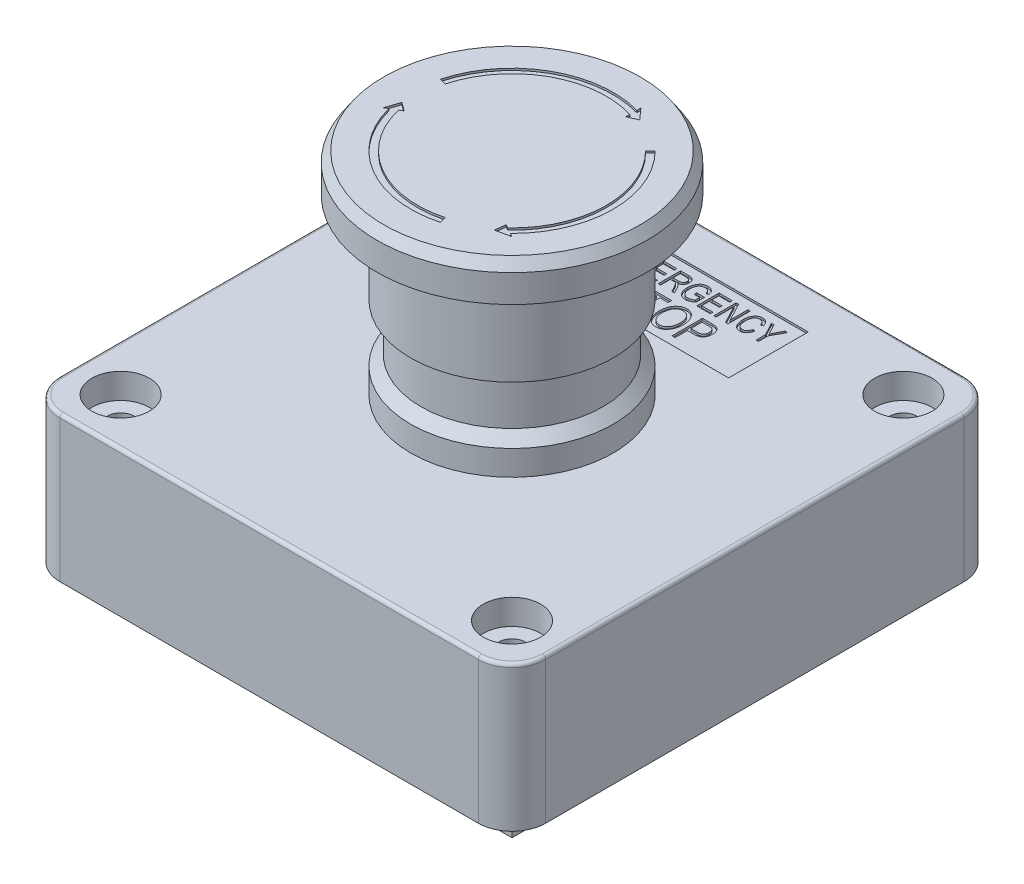
from build123d import *

# Parameters (mm, degrees)
SKETCH1_W               = 72
SKETCH1_H               = 72
BOSS_EXTRUDE1_DEPTH     = 21.5
FILLET1_R               = 5
CUT_EXTRUDE1_DEPTH      = 18.13
CUT_EXTRUDE2_DEPTH      = 56.265269383
CUT_EXTRUDE2_DEPTH_BACK = 56.265269383
SKETCH3_R               = 2
FILLET2_R               = 2
CUT_EXTRUDE3_DEPTH      = 56.265269383
CUT_EXTRUDE3_DEPTH_BACK = 0.3
SKETCH4_W               = 27.8
SKETCH4_H               = 11.8
CUT_EXTRUDE4_DEPTH      = 0.3
SKETCH8_R               = 4.25
CUT_EXTRUDE5_DEPTH      = 3.75
FILLET3_R               = 0.5
SKETCH9_R               = 12.5
BOSS_EXTRUDE2_DEPTH     = 10
BOSS_EXTRUDE3_DEPTH     = 6
SKETCH11_W              = 27
SKETCH11_H              = 27
BOSS_EXTRUDE4_DEPTH     = 24
CUT_EXTRUDE6_DEPTH      = 0.3


with BuildPart() as part:
    # Sketch1 → Boss-Extrude1 (new body)
    with BuildSketch(Plane(origin=(0, 0, 0), x_dir=(1, 0, 0), z_dir=(0, 1, 0))):
        Rectangle(SKETCH1_W, SKETCH1_H)
    extrude(amount=BOSS_EXTRUDE1_DEPTH)

    # Fillet1
    fillet1_edges = [part.edges().sort_by_distance(p)[0] for p in [
        (-36, 10.75, -36),
        (-36, 10.75, 36),
        (36, 10.75, -36),
        (36, 10.75, 36),
    ]]
    fillet(fillet1_edges, radius=FILLET1_R)

    # Sketch2 → Cut-Extrude1 (cut)
    with BuildSketch(Plane.XZ):
        Polygon((31, 12.3), (31, -16.4), (21.801694134, -26.5), (21.801694134, -31), (-21, -31), (-21, -13.290085662), (-31, -13.290085662), (-31, 15.409914338), (-20.9, 26.5), (-20.9, 31), (21, 31), (21, 12.3), align=None)
    extrude(amount=-CUT_EXTRUDE1_DEPTH, mode=Mode.SUBTRACT)

    # Sketch3 → Cut-Extrude2 (cut, two sides: drawn at the far end of the back side and taken through both)
    with BuildSketch(Plane(origin=(0, 21.5, 0), x_dir=(1, 0, 0), z_dir=(0, 1, 0)).offset(-CUT_EXTRUDE2_DEPTH_BACK)):
        with Locations((-29, 29)):
            Circle(SKETCH3_R)
        with Locations((29, 29)):
            Circle(SKETCH3_R)
        with Locations((29, -29)):
            Circle(SKETCH3_R)
        with Locations((-29, -29)):
            Circle(SKETCH3_R)
    extrude(amount=CUT_EXTRUDE2_DEPTH + CUT_EXTRUDE2_DEPTH_BACK, mode=Mode.SUBTRACT)

    # Fillet2
    fillet2_edges = [part.edges().sort_by_distance(p)[0] for p in [
        (-20.9, 9.065, 31),
        (21, 9.065, 31),
        (21, 9.065, 12.3),
        (31, 9.065, 12.3),
        (31, 9.065, -16.4),
        (21.801694134, 9.065, -26.5),
        (21.801694134, 9.065, -31),
        (-21, 9.065, -31),
        (-31, 9.065, -13.290085662),
        (-21, 9.065, -13.290085662),
        (-31, 9.065, 15.409914338),
        (-20.9, 9.065, 26.5),
    ]]
    fillet(fillet2_edges, radius=FILLET2_R)

    # Sketch4 → Cut-Extrude3 (cut, two sides: drawn at the far end of the back side and taken through both)
    with BuildSketch(Plane(origin=(0, 21.5, 0), x_dir=(1, 0, 0), z_dir=(0, 1, 0)).offset(-CUT_EXTRUDE3_DEPTH_BACK)):
        with Locations((0, 24.1)):
            Rectangle(SKETCH4_W, SKETCH4_H)
    extrude(amount=CUT_EXTRUDE3_DEPTH + CUT_EXTRUDE3_DEPTH_BACK, mode=Mode.SUBTRACT)

    # Sketch6 → Revolve2 (revolve)
    with BuildSketch(Plane.XY):
        Polygon((0, 21.5), (15, 21.5), (15, 25.2), (13.5, 26.7), (13.5, 33.7), (15, 33.7), (15, 47.2), (20, 47.2), (20, 51.3), (19, 52.8), (0, 52.8), align=None)
    revolve(axis=Axis((0, 0, 0), (0, 1, 0)))

    # Sketch7 → Cut-Extrude4 (cut)
    # profile 1 of 13: a face of its own
    with BuildSketch(Plane(origin=(0, 21.2, 0), x_dir=(1, 0, 0), z_dir=(0, 1, 0))):
        Polygon((-11.935714286, 25.386938867), (-11.935714286, 28.686938867), (-9.964285714, 28.686938867), (-9.964285714, 28.301224581), (-11.592857143, 28.301224581), (-11.592857143, 27.272653153), (-10.05, 27.272653153), (-10.05, 26.886938867), (-11.592857143, 26.886938867), (-11.592857143, 25.772653153), (-9.921428571, 25.772653153), (-9.921428571, 25.386938867), align=None)
    # profile 2 of 13: a face of its own
    with BuildSketch(Plane(origin=(0, 21.2, 0), x_dir=(1, 0, 0), z_dir=(0, 1, 0))):
        with BuildLine():
            Line((-9.407142857, 25.386938867), (-9.407142857, 28.686938867))
            Line((-9.407142857, 28.686938867), (-8.870758929, 28.686938867))
            Line((-8.870758929, 28.686938867), (-8.228571429, 26.350554938))
            Line((-8.228571429, 26.350554938), (-8.1, 25.861715653))
            add(Edge.make_bspline(
                [(-8.1, 25.861715653), (-8.09580599, 25.877799765), (-8.086993225, 25.911596892), (-8.072040154, 25.964887601), (-8.055168036, 26.023207661), (-8.038152733, 26.087058482), (-8.018507157, 26.155524866), (-7.996972068, 26.229089658), (-7.974241018, 26.308118688), (-7.958695008, 26.362605574), (-7.950669643, 26.39073351)],
                knots=[0, 0, 0, 0, 0.72569615, 1.52488642, 2.416426408, 3.376296137, 4.409732583, 5.526177123, 6.722930645, 8, 8, 8, 8], degree=3))
            Line((-7.950669643, 26.39073351), (-7.278348214, 28.686938867))
            Line((-7.278348214, 28.686938867), (-6.792857143, 28.686938867))
            Line((-6.792857143, 28.686938867), (-6.792857143, 25.386938867))
            Line((-6.792857143, 25.386938867), (-7.135714286, 25.386938867))
            Line((-7.135714286, 25.386938867), (-7.135714286, 28.11104601))
            Line((-7.135714286, 28.11104601), (-7.927901786, 25.386938867))
            Line((-7.927901786, 25.386938867), (-8.278794643, 25.386938867))
            Line((-8.278794643, 25.386938867), (-9.064285714, 28.267072795))
            Line((-9.064285714, 28.267072795), (-9.064285714, 25.386938867))
            Line((-9.064285714, 25.386938867), (-9.407142857, 25.386938867))
        make_face()
    # profile 3 of 13: a face of its own
    with BuildSketch(Plane(origin=(0, 21.2, 0), x_dir=(1, 0, 0), z_dir=(0, 1, 0))):
        Polygon((-6.235714286, 25.386938867), (-6.235714286, 28.686938867), (-4.264285714, 28.686938867), (-4.264285714, 28.301224581), (-5.892857143, 28.301224581), (-5.892857143, 27.272653153), (-4.35, 27.272653153), (-4.35, 26.886938867), (-5.892857143, 26.886938867), (-5.892857143, 25.772653153), (-4.221428571, 25.772653153), (-4.221428571, 25.386938867), align=None)
    # profile 4 of 13: a face of its own
    with BuildSketch(Plane(origin=(0, 21.2, 0), x_dir=(1, 0, 0), z_dir=(0, 1, 0))):
        with BuildLine():
            Line((-3.707142857, 25.386938867), (-3.707142857, 28.686938867))
            Line((-3.707142857, 28.686938867), (-2.495089286, 28.686938867))
            add(Edge.make_bspline(
                [(-2.495089286, 28.686938867), (-2.464501753, 28.686762801), (-2.405296434, 28.686422009), (-2.319528953, 28.68151951), (-2.239778603, 28.674262263), (-2.166151633, 28.664612953), (-2.099077856, 28.651235194), (-2.038291278, 28.635007012), (-1.983297374, 28.616892967), (-1.918736611, 28.587013686), (-1.845080961, 28.540667961), (-1.765643396, 28.470057906), (-1.696062565, 28.382616466), (-1.634145944, 28.282149706), (-1.583298101, 28.169349319), (-1.547280302, 28.046333646), (-1.525537065, 27.914718958), (-1.522821889, 27.8240774), (-1.521428571, 27.777563867)],
                knots=[0, 0, 0, 0, 0.957775898, 1.853873864, 2.6892683, 3.465319774, 4.178195347, 4.829309051, 5.435011313, 5.988660553, 7.053440284, 8.147710094, 9.30058322, 10.540256924, 11.835580405, 13.162637032, 14.543981594, 16, 16, 16, 16], degree=3))
            add(Edge.make_bspline(
                [(-1.521428571, 27.777563867), (-1.522157073, 27.74674054), (-1.523580063, 27.686532947), (-1.53220016, 27.598288282), (-1.547179898, 27.514583581), (-1.570088836, 27.435635435), (-1.596657587, 27.360462782), (-1.631545778, 27.290383354), (-1.671573329, 27.224492076), (-1.718096702, 27.163312675), (-1.770134804, 27.106981577), (-1.828536729, 27.056384235), (-1.892166907, 27.010802188), (-1.96152148, 26.970635671), (-2.036171216, 26.935370542), (-2.11699912, 26.907230465), (-2.202745471, 26.882587464), (-2.262389386, 26.871284276), (-2.292857143, 26.865510295)],
                knots=[0, 0, 0, 0, 1.121977975, 2.191573688, 3.224240956, 4.211948119, 5.180998842, 6.122125515, 7.055751929, 7.983633331, 8.914994346, 9.842128418, 10.791356962, 11.759862547, 12.75578979, 13.791489111, 14.871831714, 16, 16, 16, 16], degree=3))
            add(Edge.make_bspline(
                [(-2.292857143, 26.865510295), (-2.27036884, 26.853068063), (-2.227559839, 26.82938288), (-2.168974159, 26.791169106), (-2.118905971, 26.752705058), (-2.090601961, 26.724714292), (-2.077232143, 26.711492438)],
                knots=[0, 0, 0, 0, 1.158843086, 2.205987482, 3.152571606, 4, 4, 4, 4], degree=3))
            add(Edge.make_bspline(
                [(-2.077232143, 26.711492438), (-2.050490669, 26.679214406), (-1.996707016, 26.614295376), (-1.922978184, 26.510725204), (-1.852355677, 26.402983255), (-1.810882815, 26.327192348), (-1.789955357, 26.288947795)],
                knots=[0, 0, 0, 0, 0.982253192, 1.975551771, 2.978451105, 4, 4, 4, 4], degree=3))
            Line((-1.789955357, 26.288947795), (-1.307142857, 25.386938867))
            Line((-1.307142857, 25.386938867), (-1.696875, 25.386938867))
            Line((-1.696875, 25.386938867), (-2.077901786, 26.092742438))
            add(Edge.make_bspline(
                [(-2.077901786, 26.092742438), (-2.095651741, 26.125836639), (-2.129603168, 26.189137944), (-2.179990609, 26.279016463), (-2.226829263, 26.360073571), (-2.270040029, 26.432388323), (-2.310263275, 26.495193535), (-2.346389608, 26.549352239), (-2.379474614, 26.594247678), (-2.41907213, 26.640503539), (-2.465097809, 26.68845247), (-2.519811148, 26.736608226), (-2.574460942, 26.773939546), (-2.630101921, 26.802368554), (-2.691350689, 26.821096743), (-2.760365996, 26.835115033), (-2.840234942, 26.842739923), (-2.896860196, 26.843615529), (-2.927008929, 26.844081724)],
                knots=[0, 0, 0, 0, 1.483643366, 2.83785556, 4.070616892, 5.1822306, 6.165666296, 7.016844219, 7.754091418, 8.367230408, 9.421242841, 10.377779407, 11.241203819, 12.029974219, 12.835959019, 13.762973995, 14.808950166, 16, 16, 16, 16], degree=3))
            Line((-2.927008929, 26.844081724), (-3.364285714, 26.844081724))
            Line((-3.364285714, 26.844081724), (-3.364285714, 25.386938867))
            Line((-3.364285714, 25.386938867), (-3.707142857, 25.386938867))
        make_face()
        with BuildLine():
            Line((-3.364285714, 27.22979601), (-2.560044643, 27.22979601))
            add(Edge.make_bspline(
                [(-2.560044643, 27.22979601), (-2.518728517, 27.230600851), (-2.441298065, 27.232109203), (-2.332972886, 27.242126846), (-2.240514242, 27.260255003), (-2.162195096, 27.286657837), (-2.095411335, 27.321642485), (-2.037267321, 27.36496549), (-1.986267367, 27.416705634), (-1.942886459, 27.476552573), (-1.907017895, 27.543199354), (-1.882809512, 27.616463334), (-1.866377832, 27.694244172), (-1.864994442, 27.748010033), (-1.864285714, 27.775554938)],
                knots=[0, 0, 0, 0, 1.47306528, 2.760668081, 3.873497699, 4.82484281, 5.696997418, 6.550136397, 7.399890849, 8.276969651, 9.17766846, 10.086208714, 11.019541422, 12, 12, 12, 12], degree=3))
            add(Edge.make_bspline(
                [(-1.864285714, 27.775554938), (-1.864904699, 27.795434), (-1.866111427, 27.834188751), (-1.872460538, 27.890805742), (-1.884852127, 27.94408387), (-1.901202062, 27.994309438), (-1.923183601, 28.041023581), (-1.94885284, 28.084963685), (-1.981180283, 28.124323207), (-2.01636008, 28.16158492), (-2.057072873, 28.194664814), (-2.102538267, 28.223327798), (-2.152747097, 28.247405225), (-2.207217317, 28.268050622), (-2.267054473, 28.281783225), (-2.330856212, 28.293677123), (-2.399415651, 28.300271238), (-2.446639056, 28.300900305), (-2.470982143, 28.301224581)],
                knots=[0, 0, 0, 0, 1.045235731, 2.037714497, 2.988326782, 3.915852726, 4.808207886, 5.697550021, 6.58254782, 7.478674216, 8.387536059, 9.331464042, 10.296946822, 11.310355404, 12.385965615, 13.518246496, 14.720686494, 16, 16, 16, 16], degree=3))
            Line((-2.470982143, 28.301224581), (-3.364285714, 28.301224581))
            Line((-3.364285714, 28.301224581), (-3.364285714, 27.22979601))
        make_face(mode=Mode.SUBTRACT)
    # profile 5 of 13: a face of its own
    with BuildSketch(Plane(origin=(0, 21.2, 0), x_dir=(1, 0, 0), z_dir=(0, 1, 0))):
        with BuildLine():
            Line((0.321428571, 26.672653153), (0.321428571, 27.058367438))
            Line((0.321428571, 27.058367438), (1.478571429, 27.058367438))
            Line((1.478571429, 27.058367438), (1.478571429, 25.849662081))
            add(Edge.make_bspline(
                [(1.478571429, 25.849662081), (1.434566319, 25.809618699), (1.34844129, 25.731247405), (1.211176997, 25.62892434), (1.072205304, 25.540970046), (0.930778697, 25.469108967), (0.787151572, 25.412668127), (0.641414883, 25.37326008), (0.493458598, 25.348810078), (0.394065373, 25.345661481), (0.344196429, 25.344081724)],
                knots=[0, 0, 0, 0, 1.121144615, 2.194259096, 3.22291754, 4.218514423, 5.180530362, 6.126881594, 7.060193117, 8, 8, 8, 8], degree=3))
            add(Edge.make_bspline(
                [(0.344196429, 25.344081724), (0.311369437, 25.344844682), (0.246273277, 25.346357632), (0.149986288, 25.354779277), (0.056307974, 25.370513135), (-0.034569605, 25.391767634), (-0.122922923, 25.419120882), (-0.207978794, 25.453936757), (-0.291324343, 25.492847018), (-0.371005382, 25.53944554), (-0.447318379, 25.591589963), (-0.519760078, 25.64940555), (-0.588473512, 25.712302598), (-0.652212066, 25.781959928), (-0.712142908, 25.856829191), (-0.769024991, 25.936657995), (-0.820260228, 26.0230928), (-0.868714682, 26.11434823), (-0.911309802, 26.211298618), (-0.948322934, 26.313108942), (-0.979599264, 26.419618496), (-1.005836365, 26.530889376), (-1.025880188, 26.646956789), (-1.039561379, 26.767707305), (-1.048724436, 26.893047062), (-1.049569944, 26.978216668), (-1.05, 27.021537081)],
                knots=[0, 0, 0, 0, 0.963545397, 1.910717405, 2.833679837, 3.748938136, 4.648160849, 5.544707014, 6.44428759, 7.345417256, 8.250301349, 9.15471106, 10.063381295, 10.981308332, 11.922549023, 12.876762963, 13.855312354, 14.869185747, 15.907484256, 16.960251447, 18.046404778, 19.163470092, 20.313696906, 21.500864286, 22.728847097, 24, 24, 24, 24], degree=3))
            add(Edge.make_bspline(
                [(-1.05, 27.021537081), (-1.049551802, 27.065525007), (-1.048670412, 27.152028261), (-1.039741595, 27.279648488), (-1.025071261, 27.402771128), (-1.004869581, 27.521641273), (-0.979886467, 27.636563658), (-0.947434996, 27.746842107), (-0.910106927, 27.85290887), (-0.867036648, 27.954044305), (-0.819986506, 28.050156926), (-0.76824526, 28.139884843), (-0.713538378, 28.223497297), (-0.654135732, 28.299621122), (-0.592799106, 28.370656649), (-0.526899742, 28.434202556), (-0.457761799, 28.491686727), (-0.384384281, 28.541796399), (-0.30788955, 28.586250786), (-0.2277834, 28.624346964), (-0.14466263, 28.657325319), (-0.058107099, 28.68432925), (0.032062046, 28.704065968), (0.125523763, 28.718732707), (0.222332027, 28.728647392), (0.288144851, 28.729410222), (0.321428571, 28.72979601)],
                knots=[0, 0, 0, 0, 1.283121513, 2.523287582, 3.730023389, 4.899079804, 6.039789461, 7.15880579, 8.250410031, 9.318392136, 10.363902253, 11.370311636, 12.338384822, 13.276198214, 14.185288112, 15.074093801, 15.943727649, 16.805327304, 17.663128848, 18.522362821, 19.39060582, 20.270106898, 21.164311373, 22.080741752, 23.02936765, 24, 24, 24, 24], degree=3))
            add(Edge.make_bspline(
                [(0.321428571, 28.72979601), (0.369945799, 28.728641781), (0.464327604, 28.726396431), (0.601165087, 28.705195561), (0.728797889, 28.670680732), (0.846737386, 28.621354408), (0.955004923, 28.559516736), (1.053571683, 28.486039319), (1.142166212, 28.400936624), (1.206953542, 28.32015278), (1.253910692, 28.249494112), (1.28691251, 28.191271767), (1.317661975, 28.128481247), (1.345602993, 28.060556409), (1.37167504, 27.988144166), (1.395873332, 27.911145793), (1.417177395, 27.829272972), (1.429438934, 27.772921784), (1.435714286, 27.744081724)],
                knots=[0, 0, 0, 0, 1.421442541, 2.765168547, 4.047841273, 5.288586259, 6.501956771, 7.694182091, 8.88353085, 10.093491299, 10.721426975, 11.369099503, 12.053886711, 12.769643166, 13.521004755, 14.309514717, 15.134823968, 16, 16, 16, 16], degree=3))
            Line((1.435714286, 27.744081724), (1.092857143, 27.658367438))
            add(Edge.make_bspline(
                [(1.092857143, 27.658367438), (1.081663277, 27.700520147), (1.060588963, 27.779879635), (1.021233113, 27.889224277), (0.977413784, 27.981689332), (0.928422408, 28.059194605), (0.872134588, 28.123713319), (0.809789334, 28.180812898), (0.737807505, 28.228545784), (0.659668681, 28.270545669), (0.57443793, 28.302811733), (0.484183709, 28.327399965), (0.388389598, 28.341483937), (0.322812941, 28.343202883), (0.289285714, 28.344081724)],
                knots=[0, 0, 0, 0, 1.35370667, 2.548578037, 3.602482135, 4.525244969, 5.385205021, 6.25372376, 7.141792941, 8.059466754, 9.00287123, 9.96447941, 10.959304047, 12, 12, 12, 12], degree=3))
            add(Edge.make_bspline(
                [(0.289285714, 28.344081724), (0.264716113, 28.34375971), (0.216374066, 28.34312613), (0.144999281, 28.336203133), (0.076322127, 28.324951184), (0.010193047, 28.309237964), (-0.053565714, 28.290496671), (-0.114047953, 28.264968803), (-0.172356353, 28.23640404), (-0.228239617, 28.203477555), (-0.281542004, 28.165874656), (-0.331632661, 28.122731841), (-0.379409596, 28.075317572), (-0.423689773, 28.022125983), (-0.466624463, 27.965114054), (-0.505973251, 27.902371583), (-0.5430332, 27.83515306), (-0.576872156, 27.763076094), (-0.607905988, 27.686540041), (-0.634606088, 27.605803463), (-0.656428644, 27.520663088), (-0.675570818, 27.431862127), (-0.688993635, 27.338497244), (-0.700187132, 27.241187599), (-0.705952314, 27.139688083), (-0.706741957, 27.070650092), (-0.707142857, 27.035599581)],
                knots=[0, 0, 0, 0, 0.95244652, 1.873991161, 2.777557121, 3.648832578, 4.508552549, 5.350797697, 6.190771618, 7.02501797, 7.86316154, 8.7165405, 9.585620601, 10.469996113, 11.397859992, 12.351132043, 13.338946381, 14.372712626, 15.436726846, 16.539770861, 17.66713286, 18.84353329, 20.060284837, 21.322933361, 22.640856277, 24, 24, 24, 24], degree=3))
            add(Edge.make_bspline(
                [(-0.707142857, 27.035599581), (-0.706256535, 26.982889767), (-0.704537199, 26.880640413), (-0.690924145, 26.732328885), (-0.669393261, 26.593868454), (-0.638027249, 26.465704838), (-0.597870114, 26.347730767), (-0.549084942, 26.23972531), (-0.490780039, 26.142100661), (-0.423339259, 26.055258152), (-0.34879641, 25.97890816), (-0.268756909, 25.912145355), (-0.183418779, 25.855301343), (-0.092054482, 25.80982985), (0.003994918, 25.773150441), (0.105832292, 25.747827549), (0.212958284, 25.733068936), (0.286114266, 25.730901704), (0.3234375, 25.72979601)],
                knots=[0, 0, 0, 0, 1.344305217, 2.607756079, 3.795613497, 4.915552292, 5.968887625, 6.970219091, 7.933010886, 8.862341374, 9.768284732, 10.649651063, 11.516609893, 12.377263757, 13.247581458, 14.134137142, 15.048060964, 16, 16, 16, 16], degree=3))
            add(Edge.make_bspline(
                [(0.3234375, 25.72979601), (0.360118855, 25.730953363), (0.43461704, 25.733303895), (0.546676816, 25.752932231), (0.659764189, 25.784835664), (0.771645201, 25.827854747), (0.878282884, 25.879283066), (0.975994975, 25.93585047), (1.061833996, 25.998021128), (1.111599211, 26.044684175), (1.135714286, 26.06729601)],
                knots=[0, 0, 0, 0, 0.978162575, 1.986604247, 3.025534994, 4.109442341, 5.180230685, 6.181206173, 7.118654505, 8, 8, 8, 8], degree=3))
            Line((1.135714286, 26.06729601), (1.135714286, 26.672653153))
            Line((1.135714286, 26.672653153), (0.321428571, 26.672653153))
        make_face()
    # profile 6 of 13: a face of its own
    with BuildSketch(Plane(origin=(0, 21.2, 0), x_dir=(1, 0, 0), z_dir=(0, 1, 0))):
        Polygon((1.992857143, 25.386938867), (1.992857143, 28.686938867), (3.964285714, 28.686938867), (3.964285714, 28.301224581), (2.335714286, 28.301224581), (2.335714286, 27.272653153), (3.878571429, 27.272653153), (3.878571429, 26.886938867), (2.335714286, 26.886938867), (2.335714286, 25.772653153), (4.007142857, 25.772653153), (4.007142857, 25.386938867), align=None)
    # profile 7 of 13: a face of its own
    with BuildSketch(Plane(origin=(0, 21.2, 0), x_dir=(1, 0, 0), z_dir=(0, 1, 0))):
        Polygon((4.521428571, 25.386938867), (4.521428571, 28.686938867), (4.886383929, 28.686938867), (6.278571429, 26.056581724), (6.278571429, 28.686938867), (6.621428571, 28.686938867), (6.621428571, 25.386938867), (6.254464286, 25.386938867), (4.864285714, 28.013947795), (4.864285714, 25.386938867), align=None)
    # profile 8 of 13: a face of its own
    with BuildSketch(Plane(origin=(0, 21.2, 0), x_dir=(1, 0, 0), z_dir=(0, 1, 0))):
        with BuildLine():
            Line((9.192857143, 26.544081724), (9.535714286, 26.458367438))
            add(Edge.make_bspline(
                [(9.535714286, 26.458367438), (9.52549537, 26.412932574), (9.505572747, 26.324353542), (9.468204483, 26.196947956), (9.424538841, 26.078705678), (9.375771571, 25.969178759), (9.32151162, 25.868350399), (9.262026078, 25.776289952), (9.196814212, 25.693072665), (9.125551197, 25.619723293), (9.050615912, 25.553909478), (8.970262967, 25.498665172), (8.886909824, 25.450248595), (8.798963885, 25.411686883), (8.707312836, 25.3811442), (8.611463266, 25.360074427), (8.511804617, 25.345955094), (8.443799689, 25.344711329), (8.409375, 25.344081724)],
                knots=[0, 0, 0, 0, 1.289221957, 2.51344498, 3.673011535, 4.776835723, 5.830430132, 6.840130389, 7.808269491, 8.7523986, 9.668123701, 10.564817631, 11.447926293, 12.333367568, 13.218722559, 14.118350969, 15.047492789, 16, 16, 16, 16], degree=3))
            add(Edge.make_bspline(
                [(8.409375, 25.344081724), (8.378992332, 25.34450096), (8.319435172, 25.345322762), (8.231788601, 25.354612744), (8.147300841, 25.36818249), (8.066167497, 25.388612036), (7.988209839, 25.413621928), (7.914180549, 25.445741903), (7.842876716, 25.482296634), (7.775114461, 25.525496854), (7.710088717, 25.57443712), (7.649544583, 25.631340328), (7.59055347, 25.69354201), (7.536138391, 25.764014369), (7.482605617, 25.839947773), (7.434478917, 25.924181361), (7.387790276, 26.014250759), (7.344793876, 26.110880196), (7.304745601, 26.213097983), (7.272041026, 26.321055883), (7.242872241, 26.432874997), (7.219722428, 26.549421987), (7.200621858, 26.670212645), (7.188526254, 26.795902547), (7.179977316, 26.925883206), (7.179045298, 27.014156184), (7.178571429, 27.059037081)],
                knots=[0, 0, 0, 0, 0.921095259, 1.805562833, 2.670327692, 3.514278933, 4.340642213, 5.150451062, 5.958900505, 6.768369716, 7.58482939, 8.423223242, 9.285360719, 10.181948201, 11.120907027, 12.10087379, 13.121233649, 14.196976745, 15.307105309, 16.44839936, 17.61583717, 18.810746038, 20.050660639, 21.323136918, 22.638994396, 24, 24, 24, 24], degree=3))
            add(Edge.make_bspline(
                [(7.178571429, 27.059037081), (7.179041428, 27.103248777), (7.179963244, 27.189961698), (7.188498184, 27.317266971), (7.20056301, 27.439624188), (7.219730879, 27.556613388), (7.242722333, 27.668743638), (7.271782236, 27.775268696), (7.3049762, 27.877064945), (7.34444781, 27.973158881), (7.388927224, 28.06362708), (7.436457203, 28.148845982), (7.487147923, 28.228823318), (7.542159634, 28.302739801), (7.601198642, 28.370411896), (7.663785772, 28.432517294), (7.730246022, 28.488669721), (7.799810392, 28.539885263), (7.872707497, 28.584273385), (7.947433913, 28.623692521), (8.024551793, 28.656399779), (8.103779694, 28.683276708), (8.185041037, 28.70416892), (8.26836644, 28.718533328), (8.353546062, 28.728664898), (8.41113042, 28.729416745), (8.440178571, 28.72979601)],
                knots=[0, 0, 0, 0, 1.355009242, 2.657595594, 3.909622363, 5.12221665, 6.289669639, 7.416642245, 8.504963989, 9.569716403, 10.597874851, 11.593392335, 12.559484071, 13.498222117, 14.414780627, 15.309839368, 16.198178116, 17.079506653, 17.954919271, 18.811820418, 19.667108407, 20.519600343, 21.37423126, 22.235899437, 23.110108003, 24, 24, 24, 24], degree=3))
            add(Edge.make_bspline(
                [(8.440178571, 28.72979601), (8.471903336, 28.728974662), (8.534221541, 28.727361256), (8.626268406, 28.716062948), (8.714321557, 28.695513969), (8.799862169, 28.669039995), (8.881284984, 28.633251769), (8.959642023, 28.590195881), (9.034249863, 28.538964827), (9.105157221, 28.479874163), (9.172287111, 28.413655331), (9.234118937, 28.339614645), (9.290088245, 28.258080362), (9.342370216, 28.170194092), (9.387400129, 28.073813729), (9.428000652, 27.970634211), (9.464966451, 27.860479355), (9.483404132, 27.78353245), (9.492857143, 27.744081724)],
                knots=[0, 0, 0, 0, 0.969230344, 1.90389736, 2.827024372, 3.728538081, 4.635631584, 5.539103428, 6.456494714, 7.396000419, 8.355610671, 9.333534695, 10.338037519, 11.374284513, 12.454112223, 13.583699076, 14.761161004, 16, 16, 16, 16], degree=3))
            Line((9.492857143, 27.744081724), (9.15, 27.658367438))
            add(Edge.make_bspline(
                [(9.15, 27.658367438), (9.14225073, 27.686132916), (9.127137326, 27.740283942), (9.100242594, 27.81806132), (9.070827158, 27.890528276), (9.03885824, 27.957880457), (9.003258258, 28.019533417), (8.965067704, 28.075989573), (8.924221212, 28.127406092), (8.879860829, 28.172698811), (8.833462932, 28.213565497), (8.783605743, 28.248574177), (8.730703221, 28.27782069), (8.675233416, 28.302405944), (8.617021037, 28.320898441), (8.555874669, 28.334519524), (8.491956837, 28.342553935), (8.448236664, 28.343568431), (8.426116071, 28.344081724)],
                knots=[0, 0, 0, 0, 1.274827499, 2.486296693, 3.637698816, 4.732866786, 5.781146847, 6.783409552, 7.745577291, 8.681189198, 9.583979081, 10.476943643, 11.369744444, 12.253932728, 13.156290603, 14.066553906, 15.021756508, 16, 16, 16, 16], degree=3))
            add(Edge.make_bspline(
                [(8.426116071, 28.344081724), (8.382454387, 28.342464102), (8.297255233, 28.339307559), (8.174031438, 28.313050992), (8.059378655, 28.271052609), (7.97211589, 28.220657099), (7.907415736, 28.172320267), (7.861555132, 28.130995988), (7.818373363, 28.084862665), (7.777344743, 28.034359615), (7.738480242, 27.97907376), (7.703432674, 27.91833205), (7.669442765, 27.853857713), (7.638814225, 27.784274484), (7.611528313, 27.709964981), (7.587259124, 27.631090018), (7.566560135, 27.547510004), (7.549863347, 27.45897054), (7.537448748, 27.365721962), (7.527877163, 27.267687563), (7.522737615, 27.164895875), (7.521870274, 27.094756401), (7.521428571, 27.059037081)],
                knots=[0, 0, 0, 0, 1.477189771, 2.882511776, 4.245778241, 5.596752156, 6.277022015, 6.978177212, 7.684002091, 8.414723124, 9.180080371, 9.969542299, 10.787683758, 11.647234596, 12.541638645, 13.466905688, 14.440346501, 15.45581228, 16.516221105, 17.624831929, 18.790418795, 20, 20, 20, 20], degree=3))
            add(Edge.make_bspline(
                [(7.521428571, 27.059037081), (7.522275521, 27.005448853), (7.523918241, 26.90151053), (7.534392864, 26.750558179), (7.552718812, 26.609779795), (7.579621322, 26.479644673), (7.612851632, 26.35973405), (7.653281448, 26.250002059), (7.702443294, 26.150909395), (7.758608359, 26.062249925), (7.821275335, 25.984087635), (7.888889215, 25.915987302), (7.961876724, 25.858644667), (8.039351388, 25.810965902), (8.122466775, 25.77490234), (8.21005587, 25.748522473), (8.302790489, 25.732873676), (8.366234825, 25.730836959), (8.398660714, 25.72979601)],
                knots=[0, 0, 0, 0, 1.437104972, 2.787371166, 4.055570009, 5.241294904, 6.348053785, 7.389870239, 8.372351441, 9.308936623, 10.198930124, 11.053953419, 11.87666206, 12.682560998, 13.486679433, 14.299132302, 15.130700221, 16, 16, 16, 16], degree=3))
            add(Edge.make_bspline(
                [(8.398660714, 25.72979601), (8.422800611, 25.730459932), (8.470370914, 25.731768263), (8.540502572, 25.741541226), (8.608338584, 25.756653057), (8.673707061, 25.778831856), (8.735903982, 25.808065044), (8.796184409, 25.84210006), (8.853302952, 25.883574022), (8.908058276, 25.930758285), (8.959324117, 25.984724735), (9.006190233, 26.045416791), (9.049363637, 26.112339854), (9.086400833, 26.186599972), (9.120079887, 26.266641), (9.149479833, 26.353200716), (9.174299398, 26.446278628), (9.186571754, 26.510956444), (9.192857143, 26.544081724)],
                knots=[0, 0, 0, 0, 0.928044623, 1.828813311, 2.717973564, 3.597468745, 4.476963925, 5.35746386, 6.25552913, 7.186585864, 8.133765821, 9.112470931, 10.131597503, 11.191133367, 12.299110282, 13.469062082, 14.703759174, 16, 16, 16, 16], degree=3))
        make_face()
    # profile 9 of 13: a face of its own
    with BuildSketch(Plane(origin=(0, 21.2, 0), x_dir=(1, 0, 0), z_dir=(0, 1, 0))):
        with BuildLine():
            Line((10.778571429, 25.386938867), (10.778571429, 26.785153153))
            Line((10.778571429, 26.785153153), (9.75, 28.686938867))
            Line((9.75, 28.686938867), (10.134375, 28.686938867))
            Line((10.134375, 28.686938867), (10.686830357, 27.691179938))
            add(Edge.make_bspline(
                [(10.686830357, 27.691179938), (10.713580656, 27.642843806), (10.766100709, 27.547943326), (10.840360332, 27.406243976), (10.910223658, 27.268711391), (10.953543567, 27.177436239), (10.974776786, 27.132697795)],
                knots=[0, 0, 0, 0, 1.054805564, 2.070946718, 3.054476075, 4, 4, 4, 4], degree=3))
            add(Edge.make_bspline(
                [(10.974776786, 27.132697795), (10.994908684, 27.177424098), (11.036473316, 27.269766724), (11.104568045, 27.411430591), (11.179563472, 27.561002559), (11.232267891, 27.663328243), (11.259375, 27.715956724)],
                knots=[0, 0, 0, 0, 0.906747811, 1.872085736, 2.905564156, 4, 4, 4, 4], degree=3))
            Line((11.259375, 27.715956724), (11.766294643, 28.686938867))
            Line((11.766294643, 28.686938867), (12.15, 28.686938867))
            Line((12.15, 28.686938867), (11.121428571, 26.785153153))
            Line((11.121428571, 26.785153153), (11.121428571, 25.386938867))
            Line((11.121428571, 25.386938867), (10.778571429, 25.386938867))
        make_face()
    # profile 10 of 13: a face of its own
    with BuildSketch(Plane(origin=(0, 21.2, 0), x_dir=(1, 0, 0), z_dir=(0, 1, 0))):
        with BuildLine():
            Line((-6.75, 21.177717651), (-6.282467532, 21.23615921))
            add(Edge.make_bspline(
                [(-6.282467532, 21.23615921), (-6.275659987, 21.176638545), (-6.262749425, 21.063757149), (-6.22738956, 20.905676484), (-6.180095629, 20.768336879), (-6.121667068, 20.648971518), (-6.046791525, 20.547790095), (-5.961264354, 20.456794314), (-5.860525619, 20.377408273), (-5.747758206, 20.308103775), (-5.623639483, 20.252169407), (-5.490474482, 20.213520341), (-5.350142976, 20.188783725), (-5.254063625, 20.185757868), (-5.204951299, 20.184211158)],
                knots=[0, 0, 0, 0, 1.28056062, 2.428593037, 3.455857635, 4.381585452, 5.257863862, 6.137303782, 7.045121912, 7.991827123, 8.962072888, 9.946560163, 10.950355038, 12, 12, 12, 12], degree=3))
            add(Edge.make_bspline(
                [(-5.204951299, 20.184211158), (-5.169918304, 20.18492309), (-5.101834534, 20.186306673), (-5.002696685, 20.196713188), (-4.909319052, 20.212389382), (-4.822579725, 20.236776963), (-4.740866211, 20.2652957), (-4.666478853, 20.303316718), (-4.596868247, 20.346285965), (-4.534056077, 20.396313578), (-4.478669527, 20.452542977), (-4.42846545, 20.511555604), (-4.387645729, 20.576159912), (-4.353225333, 20.643808611), (-4.327983549, 20.71616709), (-4.308405322, 20.791794507), (-4.297490518, 20.872104064), (-4.29614384, 20.926874871), (-4.295454545, 20.95490921)],
                knots=[0, 0, 0, 0, 1.25000475, 2.42928239, 3.554432982, 4.624373226, 5.641561959, 6.637472043, 7.59895824, 8.557494333, 9.494616268, 10.412591127, 11.316575992, 12.215324116, 13.115580924, 14.045624415, 14.999656403, 16, 16, 16, 16], degree=3))
            add(Edge.make_bspline(
                [(-4.295454545, 20.95490921), (-4.296459628, 20.987242582), (-4.298417285, 21.050220137), (-4.31508018, 21.141898759), (-4.343491233, 21.226858058), (-4.382168866, 21.305748405), (-4.432121897, 21.377936263), (-4.493812311, 21.443068398), (-4.567116681, 21.500641896), (-4.63706313, 21.54430472), (-4.704632547, 21.576106954), (-4.768470747, 21.603520085), (-4.84535224, 21.632436389), (-4.935152461, 21.66355949), (-5.037899843, 21.695983052), (-5.153651008, 21.730723828), (-5.282001367, 21.768237272), (-5.37232348, 21.793012564), (-5.419541396, 21.805964404)],
                knots=[0, 0, 0, 0, 1.005239862, 1.957963033, 2.886140254, 3.783827184, 4.682063204, 5.60636897, 6.563082868, 7.574767638, 8.163399764, 8.884479363, 9.735568196, 10.717712603, 11.840607427, 13.08667948, 14.476996158, 16, 16, 16, 16], degree=3))
            add(Edge.make_bspline(
                [(-5.419541396, 21.805964404), (-5.461916293, 21.817920489), (-5.54357925, 21.840961706), (-5.660686116, 21.877836619), (-5.768558125, 21.913630454), (-5.866530359, 21.951818525), (-5.955833236, 21.988086056), (-6.0347087, 22.027006556), (-6.104364662, 22.065116115), (-6.184472211, 22.11567316), (-6.271969095, 22.18638195), (-6.364703665, 22.280865494), (-6.445713304, 22.385487032), (-6.51330132, 22.500237422), (-6.568118357, 22.623707679), (-6.604416522, 22.756799687), (-6.629733104, 22.896825765), (-6.631974774, 22.993244322), (-6.633116883, 23.042368625)],
                knots=[0, 0, 0, 0, 1.113815205, 2.146493548, 3.105946624, 3.988323839, 4.806360381, 5.543364066, 6.212027532, 6.814445107, 7.937696897, 9.048553401, 10.157540001, 11.276136463, 12.410655589, 13.563606105, 14.758681343, 16, 16, 16, 16], degree=3))
            add(Edge.make_bspline(
                [(-6.633116883, 23.042368625), (-6.632109082, 23.086559398), (-6.630127948, 23.173429552), (-6.613215414, 23.300575221), (-6.586407834, 23.421973638), (-6.546405603, 23.536328191), (-6.497464701, 23.645267517), (-6.43548588, 23.746605039), (-6.363817636, 23.842769225), (-6.280842326, 23.931474391), (-6.189451725, 24.012826327), (-6.088600358, 24.082748714), (-5.980417149, 24.142001021), (-5.864879486, 24.192063874), (-5.740925156, 24.229082464), (-5.609732437, 24.255139659), (-5.471126152, 24.272262687), (-5.376067326, 24.274151506), (-5.327313312, 24.275120248)],
                knots=[0, 0, 0, 0, 1.048547399, 2.061232895, 3.039277619, 3.994368589, 4.931972946, 5.868741773, 6.808014961, 7.774272834, 8.746911737, 9.706990873, 10.680354074, 11.670809819, 12.690200298, 13.744432806, 14.843158913, 16, 16, 16, 16], degree=3))
            add(Edge.make_bspline(
                [(-5.327313312, 24.275120248), (-5.260845391, 24.273264621), (-5.131149013, 24.269643804), (-4.943015763, 24.239361462), (-4.767814686, 24.188059429), (-4.60621182, 24.116671749), (-4.459468883, 24.026549717), (-4.330102782, 23.917146791), (-4.217242767, 23.79090975), (-4.123354031, 23.646480334), (-4.047363977, 23.487160718), (-3.991719781, 23.31365591), (-3.955443156, 23.126897511), (-3.948416974, 22.997487224), (-3.944805195, 22.930964404)],
                knots=[0, 0, 0, 0, 1.10297814, 2.152200164, 3.153123011, 4.125894755, 5.076644034, 6.001845166, 6.928824672, 7.877651763, 8.851800581, 9.850539915, 10.895078977, 12, 12, 12, 12], degree=3))
            Line((-3.944805195, 22.930964404), (-4.412337662, 22.872522846))
            add(Edge.make_bspline(
                [(-4.412337662, 22.872522846), (-4.415767378, 22.908508302), (-4.422455587, 22.978682721), (-4.440935203, 23.07963218), (-4.464554482, 23.173754474), (-4.494167023, 23.260534982), (-4.53137699, 23.339652315), (-4.572805677, 23.41200639), (-4.621060996, 23.47684957), (-4.674899222, 23.53453781), (-4.734911318, 23.585056129), (-4.800293993, 23.629333924), (-4.871603143, 23.666838451), (-4.94896556, 23.696730816), (-5.031374383, 23.720783113), (-5.119832509, 23.73677957), (-5.213843301, 23.746999232), (-5.278584072, 23.748418352), (-5.311789773, 23.749146223)],
                knots=[0, 0, 0, 0, 1.225165016, 2.389166377, 3.475498799, 4.513395989, 5.492249234, 6.435697439, 7.335638185, 8.226419293, 9.105162265, 9.989643781, 10.899061877, 11.830466535, 12.797276613, 13.805291738, 14.874328703, 16, 16, 16, 16], degree=3))
            add(Edge.make_bspline(
                [(-5.311789773, 23.749146223), (-5.345612161, 23.748856529), (-5.410986236, 23.74829659), (-5.506068207, 23.737251289), (-5.595103145, 23.722664048), (-5.678211891, 23.700450503), (-5.754678256, 23.672416461), (-5.825566062, 23.63818711), (-5.889912575, 23.597447936), (-5.94806624, 23.550474477), (-5.998994846, 23.498242178), (-6.043797896, 23.442692631), (-6.08211276, 23.383611086), (-6.11197539, 23.320106135), (-6.135824317, 23.25312207), (-6.153351794, 23.182523905), (-6.163334232, 23.108096301), (-6.164824379, 23.057312615), (-6.165584416, 23.031410833)],
                knots=[0, 0, 0, 0, 1.28677749, 2.487165856, 3.639785246, 4.719183444, 5.756778416, 6.736320351, 7.710431992, 8.649732596, 9.575714218, 10.482424581, 11.363216052, 12.249555033, 13.147559346, 14.066626488, 15.013899474, 16, 16, 16, 16], degree=3))
            add(Edge.make_bspline(
                [(-6.165584416, 23.031410833), (-6.164035251, 22.984981684), (-6.161089588, 22.896698814), (-6.133550667, 22.772333485), (-6.087712118, 22.663326153), (-6.041221618, 22.603828588), (-6.01856737, 22.574836158)],
                knots=[0, 0, 0, 0, 1.135097977, 2.158336086, 3.102579849, 4, 4, 4, 4], degree=3))
            add(Edge.make_bspline(
                [(-6.01856737, 22.574836158), (-6.004657576, 22.560965556), (-5.974446226, 22.53083933), (-5.916260201, 22.492883464), (-5.846998847, 22.452952639), (-5.763063396, 22.416736761), (-5.667512882, 22.378763397), (-5.557934806, 22.343949076), (-5.435718951, 22.307927769), (-5.349020534, 22.286536773), (-5.303571429, 22.275323171)],
                knots=[0, 0, 0, 0, 0.600125557, 1.303441474, 2.117395318, 3.047759802, 4.098473224, 5.265768101, 6.566659033, 8, 8, 8, 8], degree=3))
            add(Edge.make_bspline(
                [(-5.303571429, 22.275323171), (-5.258788506, 22.264519335), (-5.172738185, 22.24375978), (-5.049335227, 22.211382523), (-4.935967586, 22.181455243), (-4.832803647, 22.152793316), (-4.74055975, 22.123137398), (-4.658421216, 22.095642987), (-4.585920956, 22.071090484), (-4.542207468, 22.052167377), (-4.521915584, 22.043383235)],
                knots=[0, 0, 0, 0, 1.354590389, 2.602843464, 3.751324185, 4.802492375, 5.750771121, 6.599881396, 7.350062303, 8, 8, 8, 8], degree=3))
            add(Edge.make_bspline(
                [(-4.521915584, 22.043383235), (-4.467173586, 22.01690547), (-4.361038612, 21.965569804), (-4.219555664, 21.86494345), (-4.098379735, 21.750604043), (-3.999776557, 21.620016063), (-3.921954042, 21.476056293), (-3.867442004, 21.318155413), (-3.833706829, 21.147489958), (-3.829886094, 21.02934027), (-3.827922078, 20.96860645)],
                knots=[0, 0, 0, 0, 1.070280572, 2.075083192, 3.046573603, 3.996247495, 4.946860593, 5.919165523, 6.930365132, 8, 8, 8, 8], degree=3))
            add(Edge.make_bspline(
                [(-3.827922078, 20.96860645), (-3.829908123, 20.907570786), (-3.833832366, 20.786969931), (-3.868662217, 20.610565049), (-3.925570622, 20.442456608), (-4.005170048, 20.285373542), (-4.102582462, 20.140750972), (-4.21721571, 20.012460073), (-4.349581273, 19.903638525), (-4.497821091, 19.813781311), (-4.661945722, 19.742484131), (-4.842660872, 19.694440749), (-5.038597953, 19.663336864), (-5.174689786, 19.659976454), (-5.24512987, 19.658237132)],
                knots=[0, 0, 0, 0, 1.011281659, 1.998199493, 2.968653118, 3.946038549, 4.909179922, 5.852720419, 6.788493457, 7.73981833, 8.718701351, 9.744837575, 10.832745308, 12, 12, 12, 12], degree=3))
            add(Edge.make_bspline(
                [(-5.24512987, 19.658237132), (-5.300585541, 19.65939998), (-5.408800035, 19.661669127), (-5.566507165, 19.681208237), (-5.715435074, 19.712999467), (-5.855915471, 19.757801798), (-5.988159938, 19.815552512), (-6.112023617, 19.885989534), (-6.226891717, 19.969602426), (-6.331859771, 20.065805311), (-6.426786442, 20.172543816), (-6.510431882, 20.288926675), (-6.581186163, 20.415233761), (-6.639128199, 20.550435112), (-6.686254558, 20.694288392), (-6.720715494, 20.847117921), (-6.74274384, 21.009401572), (-6.747543231, 21.120729687), (-6.75, 21.177717651)],
                knots=[0, 0, 0, 0, 1.104995383, 2.156254069, 3.161771291, 4.136451373, 5.090038804, 6.032932257, 6.970972664, 7.915738022, 8.865457713, 9.813334699, 10.766787024, 11.745048075, 12.740780621, 13.779854267, 14.863525297, 16, 16, 16, 16], degree=3))
        make_face()
    # profile 11 of 13: a face of its own
    with BuildSketch(Plane(origin=(0, 21.2, 0), x_dir=(1, 0, 0), z_dir=(0, 1, 0))):
        Polygon((-2.25, 19.71667869), (-2.25, 23.690704664), (-3.477272727, 23.690704664), (-3.477272727, 24.21667869), (-0.555194805, 24.21667869), (-0.555194805, 23.690704664), (-1.782467532, 23.690704664), (-1.782467532, 19.71667869), align=None)
    # profile 12 of 13: a face of its own
    with BuildSketch(Plane(origin=(0, 21.2, 0), x_dir=(1, 0, 0), z_dir=(0, 1, 0))):
        with BuildLine():
            add(Edge.make_bspline(
                [(-0.146103896, 21.907323982), (-0.144514423, 21.99960073), (-0.141419131, 22.179297603), (-0.117824726, 22.440560615), (-0.077744969, 22.685302686), (-0.022698549, 22.913758752), (0.049626663, 23.125518024), (0.137080476, 23.321402625), (0.241551196, 23.50050032), (0.361511526, 23.662025899), (0.492367677, 23.806275159), (0.633228089, 23.931300126), (0.781126796, 24.038217039), (0.937897127, 24.12420733), (1.101520593, 24.193377869), (1.274284854, 24.239674552), (1.454143067, 24.270624027), (1.576875964, 24.27360756), (1.639103084, 24.275120248)],
                knots=[0, 0, 0, 0, 1.331070849, 2.592086014, 3.780305682, 4.906005075, 5.978011684, 7.003908552, 7.995748348, 8.962674125, 9.901370513, 10.800246893, 11.675154716, 12.528146756, 13.374603752, 14.231114787, 15.103152967, 16, 16, 16, 16], degree=3))
            add(Edge.make_bspline(
                [(1.639103084, 24.275120248), (1.679927698, 24.274216282), (1.760559585, 24.272430877), (1.880134667, 24.258985912), (1.996935678, 24.238664194), (2.110860558, 24.20774684), (2.222532549, 24.169766184), (2.331120372, 24.12212429), (2.436698238, 24.065737844), (2.539696154, 24.002399643), (2.638534889, 23.929925874), (2.732443946, 23.849556893), (2.82155839, 23.761622405), (2.904457324, 23.665427354), (2.982522051, 23.561885975), (3.054451643, 23.450283643), (3.121229639, 23.330899036), (3.18315409, 23.204532693), (3.238888655, 23.071072963), (3.28760054, 22.931232506), (3.327076175, 22.78451339), (3.361451116, 22.632353754), (3.386329382, 22.47333245), (3.405907916, 22.308606132), (3.416741713, 22.137279838), (3.418126627, 22.021177311), (3.418831169, 21.962112943)],
                knots=[0, 0, 0, 0, 0.899824171, 1.777224896, 2.649917024, 3.510973429, 4.376801712, 5.248254587, 6.121797682, 7.013780974, 7.911701495, 8.820786024, 9.736582303, 10.668970754, 11.617827344, 12.593151753, 13.593637019, 14.632021419, 15.69381936, 16.780371356, 17.893899404, 19.04171746, 20.217729733, 21.440466177, 22.69789874, 24, 24, 24, 24], degree=3))
            add(Edge.make_bspline(
                [(3.418831169, 21.962112943), (3.417361878, 21.881414073), (3.414484687, 21.723388139), (3.393942113, 21.491932984), (3.35658467, 21.272236919), (3.308553665, 21.063176379), (3.243144333, 20.866387801), (3.164395939, 20.680876546), (3.072014431, 20.506110963), (2.997455512, 20.39901936), (2.960430195, 20.345838593)],
                knots=[0, 0, 0, 0, 1.133525988, 2.219690354, 3.25996653, 4.261750254, 5.229810789, 6.168477289, 7.090481605, 8, 8, 8, 8], degree=3))
            add(Edge.make_bspline(
                [(2.960430195, 20.345838593), (2.91771809, 20.291307271), (2.834232205, 20.184719321), (2.692233475, 20.043791157), (2.54041225, 19.924783169), (2.379038843, 19.826123449), (2.20699518, 19.751399621), (2.025649454, 19.696983851), (1.834160849, 19.66447054), (1.703149082, 19.660341817), (1.636363636, 19.658237132)],
                knots=[0, 0, 0, 0, 1.070119256, 2.09167529, 3.083880958, 4.046692552, 5.007570185, 5.975302747, 6.967876608, 8, 8, 8, 8], degree=3))
            add(Edge.make_bspline(
                [(1.636363636, 19.658237132), (1.56926459, 19.660268327), (1.437578737, 19.664254669), (1.244812189, 19.697913236), (1.062473945, 19.753828774), (0.889580051, 19.83094278), (0.727887999, 19.931671378), (0.576520283, 20.054353245), (0.434514022, 20.198384408), (0.35186716, 20.307990679), (0.30955763, 20.36410158)],
                knots=[0, 0, 0, 0, 1.027712946, 2.016947528, 2.987811303, 3.944031492, 4.90967079, 5.89821231, 6.924028725, 8, 8, 8, 8], degree=3))
            add(Edge.make_bspline(
                [(0.30955763, 20.36410158), (0.272957446, 20.418283146), (0.199973721, 20.52632557), (0.107905027, 20.699748425), (0.028932999, 20.880638481), (-0.034529216, 21.070293582), (-0.085383492, 21.267610981), (-0.120512538, 21.473462192), (-0.141849072, 21.6877154), (-0.144669885, 21.833308916), (-0.146103896, 21.907323982)],
                knots=[0, 0, 0, 0, 0.958933014, 1.912189966, 2.876424288, 3.85247362, 4.843745406, 5.863745303, 6.913996742, 8, 8, 8, 8], degree=3))
        make_face()
        with BuildLine():
            add(Edge.make_bspline(
                [(0.321428571, 21.900018787), (0.322756013, 21.833932597), (0.325336121, 21.705482854), (0.342413597, 21.518314699), (0.372438902, 21.342454526), (0.414451494, 21.17791918), (0.466786023, 21.02422675), (0.533151615, 20.882794243), (0.610915316, 20.752277573), (0.700305514, 20.633712254), (0.798625401, 20.528610267), (0.901993166, 20.436008147), (1.011703188, 20.359319131), (1.125147713, 20.294299758), (1.244815821, 20.244624007), (1.369718119, 20.210266676), (1.499541187, 20.188403448), (1.587879121, 20.185622501), (1.632711039, 20.184211158)],
                knots=[0, 0, 0, 0, 1.312267352, 2.550614609, 3.728111592, 4.851026838, 5.919546711, 6.947055793, 7.94734328, 8.931337301, 9.889295514, 10.801324679, 11.681722049, 12.542374657, 13.393208477, 14.246700222, 15.110192087, 16, 16, 16, 16], degree=3))
            add(Edge.make_bspline(
                [(1.632711039, 20.184211158), (1.678446661, 20.185666756), (1.768882587, 20.188545004), (1.9016219, 20.20984885), (2.028656269, 20.245340662), (2.149288677, 20.296608078), (2.26469194, 20.360432739), (2.374303536, 20.438952701), (2.477732438, 20.532013536), (2.575461443, 20.638466536), (2.663951507, 20.759371143), (2.742268283, 20.893311915), (2.806898641, 21.041572544), (2.859236333, 21.202935531), (2.901827237, 21.377093263), (2.929740502, 21.565092139), (2.948944272, 21.765995409), (2.950498892, 21.904535229), (2.951298701, 21.975810184)],
                knots=[0, 0, 0, 0, 0.878770405, 1.737648083, 2.57658969, 3.407764765, 4.250999223, 5.106523145, 5.993164277, 6.920704469, 7.879005581, 8.867335561, 9.896730148, 10.980825599, 12.124467321, 13.338272289, 14.63061378, 16, 16, 16, 16], degree=3))
            add(Edge.make_bspline(
                [(2.951298701, 21.975810184), (2.950852469, 22.022699415), (2.949973604, 22.115048935), (2.940602679, 22.251897862), (2.924892921, 22.384670167), (2.904644082, 22.514169755), (2.875303267, 22.6390081), (2.843364892, 22.761127842), (2.802851617, 22.878886973), (2.771475963, 22.955157922), (2.75588474, 22.99305856)],
                knots=[0, 0, 0, 0, 1.078644903, 2.124418214, 3.153743212, 4.154196665, 5.137842886, 6.102739285, 7.057211248, 8, 8, 8, 8], degree=3))
            add(Edge.make_bspline(
                [(2.75588474, 22.99305856), (2.729539048, 23.048490828), (2.677475991, 23.158033338), (2.571033016, 23.304618582), (2.447816458, 23.435592628), (2.305558621, 23.545439551), (2.152071265, 23.636540022), (1.988704734, 23.702145084), (1.817852024, 23.741904474), (1.701405689, 23.746720537), (1.642755682, 23.749146223)],
                knots=[0, 0, 0, 0, 1.032714874, 2.040800129, 3.038924044, 4.055125724, 5.060150422, 6.038733642, 7.012177711, 8, 8, 8, 8], degree=3))
            add(Edge.make_bspline(
                [(1.642755682, 23.749146223), (1.595806772, 23.747691736), (1.503258028, 23.744824557), (1.36773654, 23.723690251), (1.238830001, 23.687808777), (1.116435143, 23.637910734), (0.999736058, 23.575102231), (0.890306423, 23.496108683), (0.787019893, 23.403801755), (0.690861678, 23.297075044), (0.602141255, 23.176771049), (0.528009438, 23.038635728), (0.462591506, 22.887144029), (0.411321963, 22.719113198), (0.369839953, 22.536388255), (0.343249685, 22.337707274), (0.32361902, 22.124130878), (0.322175799, 21.976470131), (0.321428571, 21.900018787)],
                knots=[0, 0, 0, 0, 0.879508816, 1.733744975, 2.562624688, 3.381316754, 4.205651284, 5.039714663, 5.904114686, 6.796492674, 7.727389142, 8.697387403, 9.727116746, 10.814853576, 11.984051762, 13.234256004, 14.568036196, 16, 16, 16, 16], degree=3))
        make_face(mode=Mode.SUBTRACT)
    # profile 13 of 13: a face of its own
    with BuildSketch(Plane(origin=(0, 21.2, 0), x_dir=(1, 0, 0), z_dir=(0, 1, 0))):
        with BuildLine():
            Line((4.003246753, 19.71667869), (4.003246753, 24.21667869))
            Line((4.003246753, 24.21667869), (5.389407468, 24.21667869))
            add(Edge.make_bspline(
                [(5.389407468, 24.21667869), (5.428985653, 24.216715829), (5.505128167, 24.216787279), (5.615299524, 24.21139721), (5.71772702, 24.205950685), (5.812051364, 24.195441284), (5.898343921, 24.183965398), (5.976516559, 24.169624895), (6.046584887, 24.151500931), (6.090169664, 24.136858701), (6.110795455, 24.129929502)],
                knots=[0, 0, 0, 0, 1.301145482, 2.503209419, 3.626350361, 4.67304202, 5.622796861, 6.488461115, 7.284688674, 8, 8, 8, 8], degree=3))
            add(Edge.make_bspline(
                [(6.110795455, 24.129929502), (6.136912967, 24.119820601), (6.189086101, 24.099626755), (6.262574947, 24.059759982), (6.332678277, 24.014846056), (6.398601596, 23.963714854), (6.45995826, 23.905578294), (6.517708694, 23.841713754), (6.570705544, 23.770808342), (6.619534823, 23.694372263), (6.665002433, 23.613176669), (6.702543372, 23.526228671), (6.736266298, 23.435361427), (6.761924301, 23.339510665), (6.783607755, 23.239354389), (6.797418402, 23.134589053), (6.807261802, 23.025206614), (6.808042329, 22.950773206), (6.808441558, 22.912701417)],
                knots=[0, 0, 0, 0, 0.897158766, 1.79219156, 2.674738776, 3.564969572, 4.462552928, 5.381685756, 6.322532571, 7.297145314, 8.28871417, 9.302465757, 10.330585605, 11.393732126, 12.480975679, 13.614163778, 14.779673607, 16, 16, 16, 16], degree=3))
            add(Edge.make_bspline(
                [(6.808441558, 22.912701417), (6.807668564, 22.862746644), (6.806156769, 22.765046823), (6.791313271, 22.622148905), (6.766643854, 22.48666138), (6.732985065, 22.35793336), (6.689271162, 22.236159245), (6.635141112, 22.121659037), (6.571640201, 22.014022677), (6.499144773, 21.913049325), (6.413715867, 21.821139218), (6.312893065, 21.742510794), (6.198821003, 21.675262841), (6.070075664, 21.621811238), (5.927970331, 21.578636793), (5.771216687, 21.549204182), (5.600420403, 21.532157247), (5.481980736, 21.5296628), (5.420454545, 21.528367002)],
                knots=[0, 0, 0, 0, 1.066125632, 2.085091685, 3.062630143, 4.003547869, 4.922307223, 5.820454748, 6.703048758, 7.586837887, 8.469431897, 9.371589709, 10.306565591, 11.287746888, 12.340181319, 13.471797101, 14.68666727, 16, 16, 16, 16], degree=3))
            Line((5.420454545, 21.528367002), (4.470779221, 21.528367002))
            Line((4.470779221, 21.528367002), (4.470779221, 19.71667869))
            Line((4.470779221, 19.71667869), (4.003246753, 19.71667869))
        make_face()
        with BuildLine():
            Line((4.470779221, 22.054341028), (5.449675325, 22.054341028))
            add(Edge.make_bspline(
                [(5.449675325, 22.054341028), (5.486823925, 22.055175638), (5.558799733, 22.056792704), (5.663269616, 22.065417796), (5.76003909, 22.08186779), (5.849076814, 22.104395035), (5.930134924, 22.133770632), (6.003617787, 22.169093658), (6.069105848, 22.211608936), (6.127630741, 22.260203721), (6.17751174, 22.316665465), (6.222381923, 22.378169088), (6.258770546, 22.447618693), (6.288507702, 22.523366324), (6.312662495, 22.60516502), (6.3286, 22.693649762), (6.338787098, 22.788579614), (6.340187705, 22.854232001), (6.340909091, 22.888046385)],
                knots=[0, 0, 0, 0, 1.269306236, 2.459294321, 3.577321076, 4.618943517, 5.592639886, 6.518111891, 7.397820391, 8.253919533, 9.107995395, 9.965041305, 10.848919063, 11.777714976, 12.741869721, 13.757527659, 14.845010431, 16, 16, 16, 16], degree=3))
            add(Edge.make_bspline(
                [(6.340909091, 22.888046385), (6.339870519, 22.931968771), (6.337860823, 23.016961112), (6.317073097, 23.139214112), (6.284916637, 23.251989652), (6.237853577, 23.353019248), (6.182813875, 23.441612323), (6.12254577, 23.517397291), (6.05523386, 23.576937502), (5.992588721, 23.614047388), (5.937572575, 23.637451814), (5.888545693, 23.651894873), (5.831933714, 23.663239521), (5.767940965, 23.673173918), (5.696692102, 23.681550566), (5.618051166, 23.686485873), (5.531900434, 23.690535831), (5.47190117, 23.690646714), (5.440543831, 23.690704664)],
                knots=[0, 0, 0, 0, 1.500314686, 2.903195123, 4.226916567, 5.498136997, 6.699407891, 7.786731959, 8.797026544, 9.75363827, 10.261964553, 10.838097333, 11.497334866, 12.234733717, 13.051831226, 13.948971176, 14.928073425, 16, 16, 16, 16], degree=3))
            Line((5.440543831, 23.690704664), (4.470779221, 23.690704664))
            Line((4.470779221, 23.690704664), (4.470779221, 22.054341028))
        make_face(mode=Mode.SUBTRACT)
    extrude(amount=-CUT_EXTRUDE4_DEPTH, mode=Mode.SUBTRACT)

    # Sketch8 → Cut-Extrude5 (cut)
    with BuildSketch(Plane(origin=(0, 21.5, 0), x_dir=(1, 0, 0), z_dir=(0, 1, 0))):
        with Locations((-29, 29)):
            Circle(SKETCH8_R)
        with Locations((29, 29)):
            Circle(SKETCH8_R)
        with Locations((29, -29)):
            Circle(SKETCH8_R)
        with Locations((-29, -29)):
            Circle(SKETCH8_R)
    extrude(amount=-CUT_EXTRUDE5_DEPTH, mode=Mode.SUBTRACT)

    # Fillet3
    fillet3_edges = [part.edges().sort_by_distance(p)[0] for p in [
        (-34.535533906, 21.5, 34.535533906),
        (-36, 21.5, 0),
        (-34.535533906, 21.5, -34.535533906),
        (0, 21.5, -36),
        (34.535533906, 21.5, -34.535533906),
        (36, 21.5, 0),
        (34.535533906, 21.5, 34.535533906),
        (0, 21.5, 36),
    ]]
    fillet(fillet3_edges, radius=FILLET3_R)

    # Sketch9 → Boss-Extrude2 (add)
    with BuildSketch(Plane.XZ.offset(-18.13)):
        Circle(SKETCH9_R)
    extrude(amount=BOSS_EXTRUDE2_DEPTH)

    # Sketch10 → Boss-Extrude3 (add)
    with BuildSketch(Plane.XZ.offset(-8.13)):
        with BuildLine():
            Line((-13.5, 19.75), (-13.5, -19.75))
            Line((-13.5, -19.75), (-3, -19.75))
            ThreePointArc((-3, -19.75), (-2.47181966, -19.632906144), (-2.042610629, -19.303565817))
            ThreePointArc((-2.042610629, -19.303565817), (-0.164519718, -18.436753484), (1.699746521, -19.332912219))
            ThreePointArc((1.699746521, -19.332912219), (2.287875401, -19.73473181), (3, -19.75))
            Line((3, -19.75), (13.5, -19.75))
            Line((13.5, -19.75), (13.5, 19.75))
            Line((13.5, 19.75), (5.5, 19.75))
            ThreePointArc((5.5, 19.75), (3.580475451, 20.200393005), (2.061609566, 21.457562354))
            ThreePointArc((2.061609566, 21.457562354), (1.150919375, 22.211343056), (0, 22.481392239))
            ThreePointArc((0, 22.481392239), (-1.150919375, 22.211343056), (-2.061609566, 21.457562354))
            ThreePointArc((-2.061609566, 21.457562354), (-3.580475451, 20.200393005), (-5.5, 19.75))
            Line((-5.5, 19.75), (-13.5, 19.75))
        make_face()
    extrude(amount=BOSS_EXTRUDE3_DEPTH)

    # Sketch11 → Boss-Extrude4 (add)
    with BuildSketch(Plane.XZ.offset(-2.13)):
        Rectangle(SKETCH11_W, SKETCH11_H)
    extrude(amount=BOSS_EXTRUDE4_DEPTH)

    # Sketch12 → Cut-Extrude6 (cut)
    with BuildSketch(Plane(origin=(0, 52.8, 0), x_dir=(1, 0, 0), z_dir=(0, 1, 0))):
        with BuildLine():
            Line((-13.522961568, 3.623466631), (-14.488887394, 3.882285677))
            ThreePointArc((-14.488887394, 3.882285677), (-7.420602015, 13.035899115), (4.058795827, 14.440435466))
            Line((4.058795827, 14.440435466), (4.058795827, 15.040435466))
            Line((4.058795827, 15.040435466), (5.511112606, 13.411846922))
            Line((5.511112606, 13.411846922), (4.058795827, 12.798737867))
            Line((4.058795827, 12.798737867), (4.058795827, 13.398737867))
            ThreePointArc((4.058795827, 13.398737867), (-6.803057418, 12.235947441), (-13.522961568, 3.623466631))
        make_face()
        with BuildLine():
            Line((9.054634216, -9.914389229), (9.574249458, -10.214389229))
            ThreePointArc((9.574249458, -10.214389229), (13.998170032, -0.226353173), (9.899494937, 9.899494937))
            Line((9.899494937, 9.899494937), (10.606601718, 10.606601718))
            ThreePointArc((10.606601718, 10.606601718), (14.999720802, -0.091519701), (10.476386041, -10.735238028))
            Line((10.476386041, -10.735238028), (10.996001284, -11.035238028))
            Line((10.996001284, -11.035238028), (8.859443843, -11.47868698))
            Line((8.859443843, -11.47868698), (9.054634216, -9.914389229))
        make_face()
        with BuildLine():
            Line((-13.113430043, -2.884348639), (-13.633045285, -3.184348639))
            ThreePointArc((-13.633045285, -3.184348639), (-7.195112614, -12.009594267), (3.623466631, -13.522961568))
            Line((3.623466631, -13.522961568), (3.882285677, -14.488887394))
            ThreePointArc((3.882285677, -14.488887394), (-7.579118787, -12.944379414), (-14.535181868, -3.705197438))
            Line((-14.535181868, -3.705197438), (-15.054797111, -4.005197438))
            Line((-15.054797111, -4.005197438), (-14.370556449, -1.933159941))
            Line((-14.370556449, -1.933159941), (-13.113430043, -2.884348639))
        make_face()
    extrude(amount=-CUT_EXTRUDE6_DEPTH, mode=Mode.SUBTRACT)


solid = part.part
